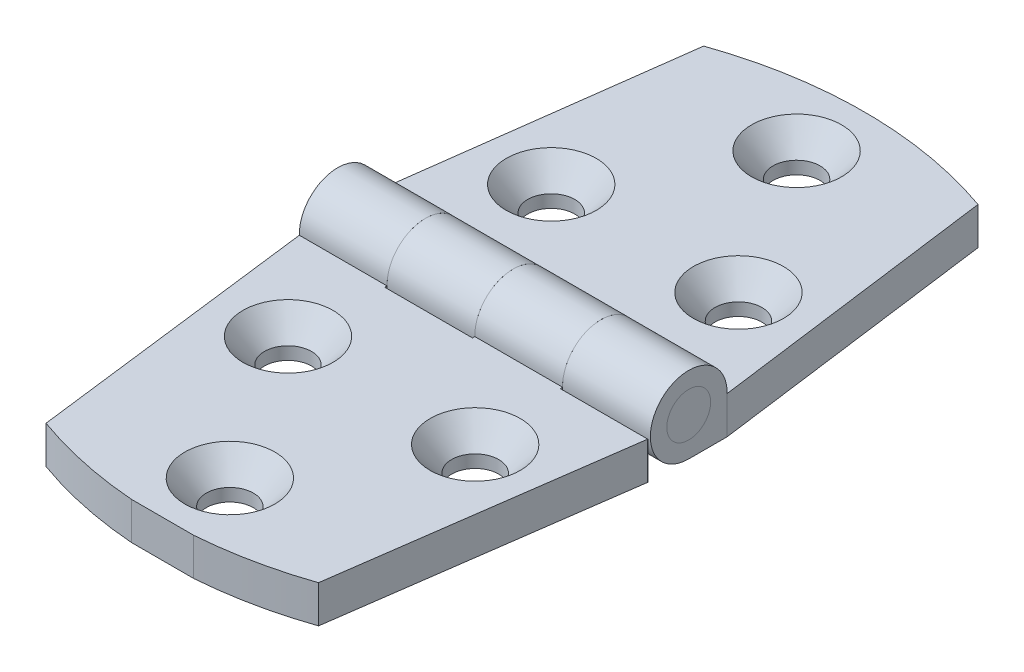
from build123d import *

# Parameters (mm, degrees)
SKETCH1_R                                    = 2.38125
LEFT_LEAF_DEPTH                              = 19.05
CUT_EXTRUDE1_DEPTH                           = 43.800443358
CUT_EXTRUDE1_DEPTH_BACK                      = 43.800443358
SKETCH2_W                                    = 9.525
SKETCH2_H                                    = 8.588375
SKETCH3_R                                    = 2.38125
RIGHT_LEAF_DEPTH                             = 19.05
CUT_EXTRUDE2_DEPTH                           = 43.800443358
CUT_EXTRUDE2_DEPTH_BACK                      = 43.800443358
SKETCH9_W                                    = 9.525
SKETCH9_H                                    = 8.842375
SKETCH10_R                                   = 2.38125
EXTRUDE1_DEPTH                               = 19.05
CUT_EXTRUDE3_DEPTH                           = 43.810613201
CSK_FOR_10_FLAT_HEAD_MACHINE_SCREW1_AT_COUNT = 2
CSK_FOR_10_FLAT_HEAD_MACHINE_SCREW1_AT_PITCH = 19.351919642
CSK_FOR_10_FLAT_HEAD_MACHINE_SCREW1_2_COUNT  = 2
CSK_FOR_10_FLAT_HEAD_MACHINE_SCREW1_2_PITCH  = 19.351919642
CSK_FOR_10_FLAT_HEAD_MACHINE_SCREW1_3_COUNT  = 2
CSK_FOR_10_FLAT_HEAD_MACHINE_SCREW1_3_PITCH  = 46.176896585
CSK_FOR_10_FLAT_HEAD_MACHINE_SCREW1_4_COUNT  = 2
CSK_FOR_10_FLAT_HEAD_MACHINE_SCREW1_4_PITCH  = 46.176896585
CSK_FOR_10_FLAT_HEAD_MACHINE_SCREW1_5_COUNT  = 2
CSK_FOR_10_FLAT_HEAD_MACHINE_SCREW1_5_PITCH  = 61.515625


with BuildPart() as part:
    # Sketch1 → Left Leaf (new, symmetric)
    with BuildSketch(Plane(origin=(0, 0, 0), x_dir=(0, 0, -1), z_dir=(1, 0, 0))):
        with BuildLine():
            Line((-38.1, -0.1031875), (-4.165909745, -0.1031875))
            ThreePointArc((-4.165909745, -0.1031875), (2.909935566, 2.982905741), (0, -4.1671875))
            Line((0, -4.1671875), (-38.1, -4.1671875))
            Line((-38.1, -4.1671875), (-38.1, -0.1031875))
        make_face()
        Circle(SKETCH1_R, mode=Mode.SUBTRACT)
    extrude(amount=LEFT_LEAF_DEPTH, both=True)

    # Sketch2 → Cut-Extrude1 (cut, two sides: drawn at the far end of the back side and taken through both)
    with BuildSketch(Plane(origin=(0, 0, 0), x_dir=(1, 0, 0), z_dir=(0, 1, 0)).offset(-CUT_EXTRUDE1_DEPTH_BACK)):
        with Locations((-4.7625, -0.127)):
            Rectangle(SKETCH2_W, SKETCH2_H)
        with Locations((14.2875, -0.127)):
            Rectangle(SKETCH2_W, SKETCH2_H)
    extrude(amount=CUT_EXTRUDE1_DEPTH + CUT_EXTRUDE1_DEPTH_BACK, mode=Mode.SUBTRACT)


with BuildPart() as body_2:
    # Sketch3 → Right Leaf (new, symmetric)
    with BuildSketch(Plane(origin=(0, 0, 0), x_dir=(0, 0, -1), z_dir=(1, 0, 0))):
        with BuildLine():
            Line((38.1, -0.1031875), (38.1, -4.1671875))
            Line((38.1, -4.1671875), (0, -4.1671875))
            ThreePointArc((0, -4.1671875), (-2.909935566, 2.982905741), (4.165909745, -0.1031875))
            Line((4.165909745, -0.1031875), (38.1, -0.1031875))
        make_face()
        Circle(SKETCH3_R, mode=Mode.SUBTRACT)
    extrude(amount=RIGHT_LEAF_DEPTH, both=True)

    # Sketch9 → Cut-Extrude2 (cut, two sides: drawn at the far end of the back side and taken through both)
    with BuildSketch(Plane(origin=(0, 0, 0), x_dir=(1, 0, 0), z_dir=(0, 1, 0)).offset(-CUT_EXTRUDE2_DEPTH_BACK)):
        with Locations((-14.2875, 0)):
            Rectangle(SKETCH9_W, SKETCH9_H)
        with Locations((4.7625, 0)):
            Rectangle(SKETCH9_W, SKETCH9_H)
    extrude(amount=CUT_EXTRUDE2_DEPTH + CUT_EXTRUDE2_DEPTH_BACK, mode=Mode.SUBTRACT)


with BuildPart() as body_3:
    # Sketch10 → Extrude1 (new, symmetric)
    with BuildSketch(Plane(origin=(0, 0, 0), x_dir=(0, 0, -1), z_dir=(1, 0, 0))):
        Circle(SKETCH10_R)
    extrude(amount=EXTRUDE1_DEPTH, both=True)


with BuildPart() as cut_extrude3_tool:
    # Sketch13 → Cut-Extrude3 (new, through all)
    with BuildSketch(Plane(origin=(0, -0.1031875, 0), x_dir=(-1, 0, 0), z_dir=(0, 1, 0))):
        with BuildLine():
            Line((19.022219059, -4.167094897), (14.889264695, -35.56))
            ThreePointArc((14.889264695, -35.56), (0, -38.1), (-14.889264695, -35.56))
            Line((-14.889264695, -35.56), (-19.05, -4.170764834))
            Line((-19.05, -4.170764834), (-24.251524546, -4.170764834))
            Line((-24.251524546, -4.170764834), (-24.251524546, -58.581674997))
            Line((-24.251524546, -58.581674997), (25.352500978, -58.581674997))
            Line((25.352500978, -58.581674997), (25.352500978, -4.167094897))
            Line((25.352500978, -4.167094897), (19.022219059, -4.167094897))
        make_face()
        with BuildLine():
            Line((-23.86002214, 58.869046819), (-24.22275751, 4.459345774))
            Line((-24.22275751, 4.459345774), (-19.021348553, 4.424669329))
            Line((-19.021348553, 4.424669329), (-14.651446465, 35.785469037))
            ThreePointArc((-14.651446465, 35.785469037), (0.254420506, 38.226151932), (15.126421188, 35.586947714))
            Line((15.126421188, 35.586947714), (19.05, 4.1671875))
            Line((19.05, 4.1671875), (25.380141248, 4.124986089))
            Line((25.380141248, 4.124986089), (25.742901085, 58.53835699))
            Line((25.742901085, 58.53835699), (-23.86002214, 58.869046819))
        make_face()
    extrude(amount=-CUT_EXTRUDE3_DEPTH)


with BuildPart() as part_1:
    add(part.part)

    # Cut-Extrude3: cut by cut_extrude3_tool
    add(cut_extrude3_tool.part, mode=Mode.SUBTRACT)


with BuildPart() as body_2_1:
    add(body_2.part)

    # Cut-Extrude3: cut by cut_extrude3_tool
    add(cut_extrude3_tool.part, mode=Mode.SUBTRACT)

    # Sketch12 → CSK for #10 Flat Head Machine Screw1 (revolve, cut)
    with BuildSketch(Plane(origin=(0, -0.1031875, -30.7578125), x_dir=(0, 0, 1), z_dir=(1, 0, 0))):
        Polygon((0, 0), (0, 4.064), (2.5527, 4.064), (2.5527, 2.688180894), (4.8895, 0), align=None)
    csk_for_10_flat_head_machine_screw1 = revolve(axis=Axis((0, 6.2468125, -30.7578125), (0, -1, 0)), mode=Mode.SUBTRACT)

    # CSK for #10 Flat Head Machine Screw1 at: CSK for #10 Flat Head Machine Screw1 ×2
    with Locations(*[Vector(-0.5250125149194884, 0, 0.8510945066077645) * (i * CSK_FOR_10_FLAT_HEAD_MACHINE_SCREW1_AT_PITCH) for i in range(1, CSK_FOR_10_FLAT_HEAD_MACHINE_SCREW1_AT_COUNT)]):
        add(csk_for_10_flat_head_machine_screw1, mode=Mode.SUBTRACT)

    # CSK for _10 Flat Head Machine Screw1 2: CSK for #10 Flat Head Machine Screw1 ×2
    with Locations(*[Vector(0.5250125149194884, 0, 0.8510945066077645) * (i * CSK_FOR_10_FLAT_HEAD_MACHINE_SCREW1_2_PITCH) for i in range(1, CSK_FOR_10_FLAT_HEAD_MACHINE_SCREW1_2_COUNT)]):
        add(csk_for_10_flat_head_machine_screw1, mode=Mode.SUBTRACT)


with BuildPart() as part_2:
    add(part_1.part)

    # CSK for _10 Flat Head Machine Screw1 3: CSK for #10 Flat Head Machine Screw1 ×2
    with Locations(*[Vector(-0.22002344790096343, 0, 0.9754945834671621) * (i * CSK_FOR_10_FLAT_HEAD_MACHINE_SCREW1_3_PITCH) for i in range(1, CSK_FOR_10_FLAT_HEAD_MACHINE_SCREW1_3_COUNT)]):
        add(csk_for_10_flat_head_machine_screw1, mode=Mode.SUBTRACT)

    # CSK for _10 Flat Head Machine Screw1 4: CSK for #10 Flat Head Machine Screw1 ×2
    with Locations(*[Vector(0.22002344790096343, 0, 0.9754945834671621) * (i * CSK_FOR_10_FLAT_HEAD_MACHINE_SCREW1_4_PITCH) for i in range(1, CSK_FOR_10_FLAT_HEAD_MACHINE_SCREW1_4_COUNT)]):
        add(csk_for_10_flat_head_machine_screw1, mode=Mode.SUBTRACT)

    # CSK for _10 Flat Head Machine Screw1 5: CSK for #10 Flat Head Machine Screw1 ×2
    with Locations(*[(0, 0, i * CSK_FOR_10_FLAT_HEAD_MACHINE_SCREW1_5_PITCH) for i in range(1, CSK_FOR_10_FLAT_HEAD_MACHINE_SCREW1_5_COUNT)]):
        add(csk_for_10_flat_head_machine_screw1, mode=Mode.SUBTRACT)


solid = Compound([body_3.part, body_2_1.part, part_2.part])
